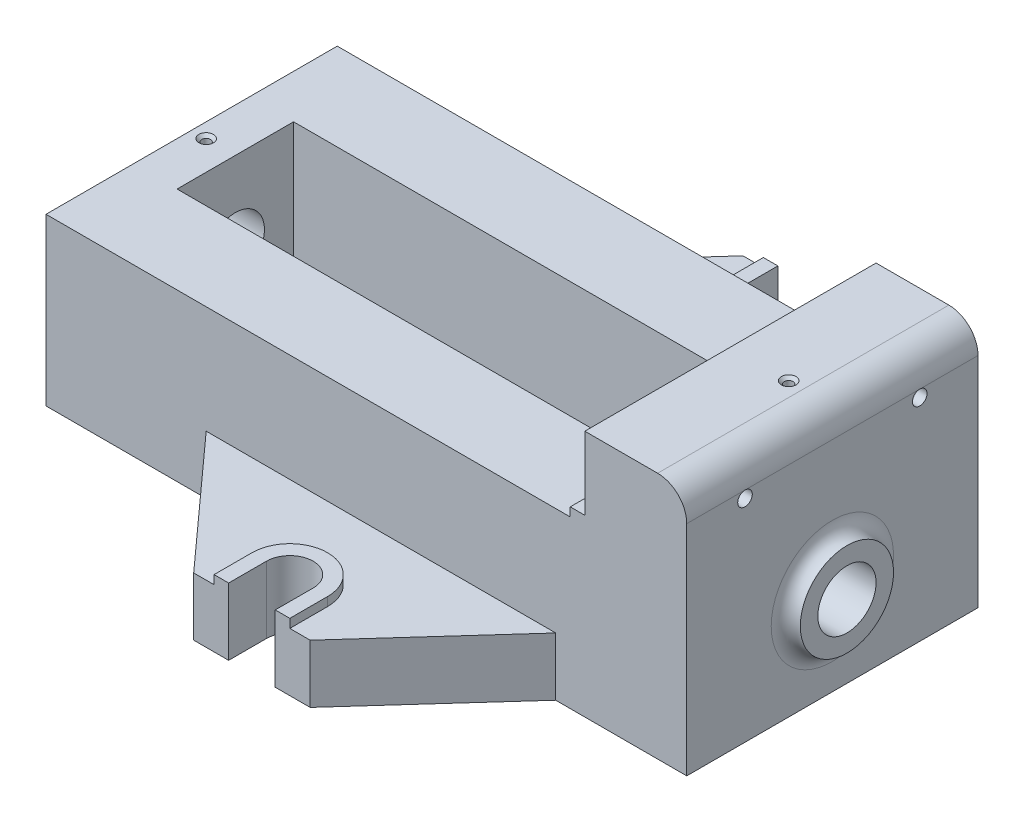
from build123d import *

# Parameters (mm, degrees)
BOSS_EXTRUDE1_DEPTH = 50
CUT_EXTRUDE1_START  = -15
CUT_EXTRUDE1_DEPTH  = 165
SKETCH3_R           = 15
BOSS_EXTRUDE2_DEPTH = 5
SKETCH4_R           = 16
BOSS_EXTRUDE3_DEPTH = 5
SKETCH5_R           = 10
CUT_EXTRUDE2_DEPTH  = 251.249875125
FILLET1_R           = 5
HOLE1_D             = 5
HOLE1_DEPTH         = 40
HOLE1_CBORE_D       = 6
HOLE1_CBORE_DEPTH   = 10
HOLE1_TIP           = 1.502151548
HOLE2_D             = 3
HOLE2_CSINK_D       = 5
HOLE2_CSINK_ANGLE   = 90
HOLE4_D             = 3
HOLE4_CSINK_D       = 5
HOLE4_CSINK_ANGLE   = 90
BOSS_EXTRUDE7_DEPTH = 20
BOSS_EXTRUDE9_DEPTH = 3


with BuildPart() as part:
    # Sketch1 → Boss-Extrude1 (new, symmetric)
    with BuildSketch(Plane.XY):
        with BuildLine():
            Line((0, 0), (220, 0))
            Line((220, 0), (220, 75))
            ThreePointArc((220, 75), (217.071067812, 82.071067812), (210, 85))
            Line((210, 85), (185, 85))
            Line((185, 85), (185, 60))
            Line((185, 60), (180, 60))
            Line((180, 60), (180, 57))
            Line((180, 57), (0, 57))
            Line((0, 57), (0, 0))
        make_face()
    extrude(amount=BOSS_EXTRUDE1_DEPTH, both=True)

    # Sketch2 → Cut-Extrude1 (cut)
    with BuildSketch(Plane.ZY.offset(CUT_EXTRUDE1_START)):
        Polygon((-30, 0), (-30, 10), (-26, 10), (-26, 13), (-20, 13), (-20, 57), (20, 57), (20, 13), (26, 13), (26, 10), (30, 10), (30, 0), align=None)
    extrude(amount=-CUT_EXTRUDE1_DEPTH, mode=Mode.SUBTRACT)

    # Sketch3 → Boss-Extrude2 (add)
    with BuildSketch(Plane.ZY):
        with Locations(Location((0, 30, 0), (0, 0, 270))):
            Circle(SKETCH3_R)
    extrude(amount=BOSS_EXTRUDE2_DEPTH)

    # Sketch4 → Boss-Extrude3 (add)
    with BuildSketch(Plane(origin=(220, 0, 0), x_dir=(0, 0, -1), z_dir=(1, 0, 0))):
        with Locations(Location((0, 30, 0), (0, 0, 180))):
            Circle(SKETCH4_R)
    extrude(amount=BOSS_EXTRUDE3_DEPTH)

    # Sketch5 → Cut-Extrude2 (cut, through all)
    with BuildSketch(Plane(origin=(225, 0, 0), x_dir=(0, 0, -1), z_dir=(1, 0, 0))):
        with Locations((0, 30)):
            Circle(SKETCH5_R)
    extrude(amount=-CUT_EXTRUDE2_DEPTH, mode=Mode.SUBTRACT)

    # Fillet1
    fillet1_edges = [part.edges().sort_by_distance(p)[0] for p in [
        (0, 45, 0),
        (220, 30, -16),
    ]]
    fillet(fillet1_edges, radius=FILLET1_R - 0.0001)  # a hair under: the kernel refuses the full size

    # Hole1
    with Locations(Plane(origin=(185, 72.5, -30), x_dir=(0, 0, -1), z_dir=(-1, 0, 0))):
        with Locations((0, 0), (-60, 0)):
            CounterBoreHole(HOLE1_D / 2, HOLE1_CBORE_D / 2, HOLE1_CBORE_DEPTH, depth=HOLE1_DEPTH)
            with Locations((0, 0, -(HOLE1_DEPTH + HOLE1_TIP / 2))):  # 118° drill point
                Cone(0, HOLE1_D / 2, HOLE1_TIP, mode=Mode.SUBTRACT)

    # Hole2 (through all)
    with Locations(Plane(origin=(205, 85, 0), x_dir=(0, 0, 1), z_dir=(0, 1, 0))):
        with Locations((0, 0)):
            CounterSinkHole(HOLE2_D / 2, HOLE2_CSINK_D / 2, counter_sink_angle=HOLE2_CSINK_ANGLE)

    # Hole4 (through all)
    with Locations(Plane(origin=(5, 57, 0), x_dir=(1, 0, 0), z_dir=(0, 1, 0))):
        with Locations((0, 0)):
            CounterSinkHole(HOLE4_D / 2, HOLE4_CSINK_D / 2, counter_sink_angle=HOLE4_CSINK_ANGLE)

    # Sketch18 → Boss-Extrude7 (add)
    with BuildSketch(Plane.XZ):
        with BuildLine():
            Line((55, 50), (95, 94.291635381))
            Line((95, 94.291635381), (107, 94.291635381))
            Line((107, 94.291635381), (107, 81.291635381))
            ThreePointArc((107, 81.291635381), (115, 73.291635381), (123, 81.291635381))
            Line((123, 81.291635381), (123, 94.291635381))
            Line((123, 94.291635381), (135, 94.291635381))
            Line((135, 94.291635381), (175, 50))
            Line((175, 50), (55, 50))
        make_face()
    boss_extrude7 = extrude(amount=-BOSS_EXTRUDE7_DEPTH)

    # Mirror4: Boss-Extrude7 across plane
    add(boss_extrude7.mirror(Plane.XY))

    # Sketch21 → Boss-Extrude9 (add)
    with BuildSketch(Plane(origin=(0, 20, 0), x_dir=(1, 0, 0), z_dir=(0, 1, 0))):
        with BuildLine():
            Line((128, 94.291635381), (128, 81.291635381))
            ThreePointArc((128, 81.291635381), (115, 68.291635381), (102, 81.291635381))
            Line((102, 81.291635381), (102, 94.291635381))
            Line((102, 94.291635381), (107, 94.291635381))
            Line((107, 94.291635381), (107, 81.291635381))
            ThreePointArc((107, 81.291635381), (115, 73.291635381), (123, 81.291635381))
            Line((123, 81.291635381), (123, 94.291635381))
            Line((123, 94.291635381), (128, 94.291635381))
        make_face()
    boss_extrude9 = extrude(amount=BOSS_EXTRUDE9_DEPTH)

    # Mirror5: Boss-Extrude9 across plane
    add(boss_extrude9.mirror(Plane.XY))


solid = part.part
